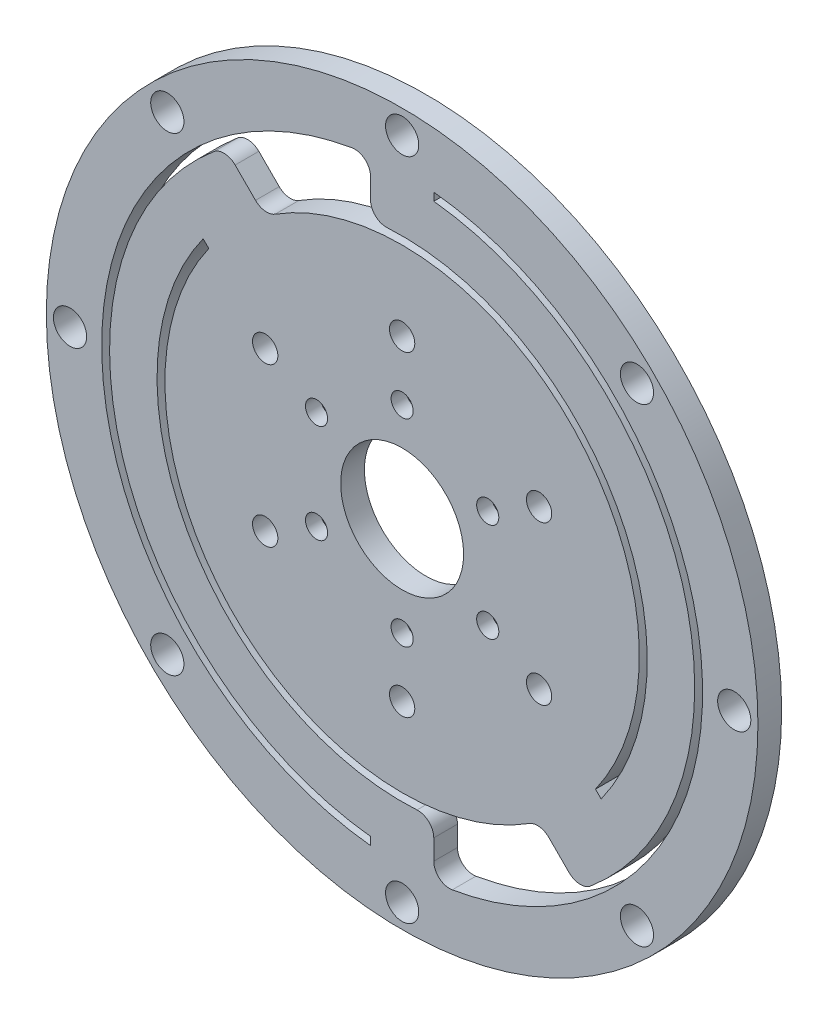
from build123d import *
from build123d.topology import SkipClean

# Parameters (mm, degrees)
EXTRUDE_1_OUTLINE_R      = 45
EXTRUDE_1_OUTLINE_R_2    = 2.1
EXTRUDE_1_OUTLINE_R_3    = 1.6
EXTRUDE_1_OUTLINE_R_4    = 7.775
EXTRUDE_1_DEPTH          = 3
CUT_EXTRUDE_1_DEPTH      = 10
PATTERN_CIRCULAR_1_COUNT = 2
CUT_EXTRUDE_2_DEPTH      = 10
FILLET_1_R               = 2
CUT_EXTRUDE_3_REACH      = 65.71
SKETCH_4_R               = 1.4
CHAMFER_1_SIZE           = 1.1


# Read off the part's stored shape, not the designer's step: 凸台-拉伸1
with BuildPart() as part:
    # 凸台-拉伸1 outline → 凸台-拉伸1 (new body)
    with BuildSketch(Plane.XY):
        Circle(EXTRUDE_1_OUTLINE_R)
        with Locations((-29.69848481, -29.69848481)):
            Circle(EXTRUDE_1_OUTLINE_R_2, mode=Mode.SUBTRACT)
        with Locations((-17.320508076, -10)):
            Circle(EXTRUDE_1_OUTLINE_R_3, mode=Mode.SUBTRACT)
        with Locations((0, -42)):
            Circle(EXTRUDE_1_OUTLINE_R_2, mode=Mode.SUBTRACT)
        with Locations((29.69848481, -29.69848481)):
            Circle(EXTRUDE_1_OUTLINE_R_2, mode=Mode.SUBTRACT)
        with Locations((0, -20)):
            Circle(EXTRUDE_1_OUTLINE_R_3, mode=Mode.SUBTRACT)
        with Locations((17.320508076, -10)):
            Circle(EXTRUDE_1_OUTLINE_R_3, mode=Mode.SUBTRACT)
        with Locations((-42, 0)):
            Circle(EXTRUDE_1_OUTLINE_R_2, mode=Mode.SUBTRACT)
        with Locations((-17.320508076, 10)):
            Circle(EXTRUDE_1_OUTLINE_R_3, mode=Mode.SUBTRACT)
        with Locations((-29.69848481, 29.69848481)):
            Circle(EXTRUDE_1_OUTLINE_R_2, mode=Mode.SUBTRACT)
        Circle(EXTRUDE_1_OUTLINE_R_4, mode=Mode.SUBTRACT)
        with Locations((17.320508076, 10)):
            Circle(EXTRUDE_1_OUTLINE_R_3, mode=Mode.SUBTRACT)
        with Locations((0, 20)):
            Circle(EXTRUDE_1_OUTLINE_R_3, mode=Mode.SUBTRACT)
        with Locations((42, 0)):
            Circle(EXTRUDE_1_OUTLINE_R_2, mode=Mode.SUBTRACT)
        with Locations((0, 42)):
            Circle(EXTRUDE_1_OUTLINE_R_2, mode=Mode.SUBTRACT)
        with Locations((29.69848481, 29.69848481)):
            Circle(EXTRUDE_1_OUTLINE_R_2, mode=Mode.SUBTRACT)
    extrude(amount=EXTRUDE_1_DEPTH)

    # 草图2 → 切除-拉伸1 (cut)
    with BuildSketch(Plane.XY.offset(3)):
        with BuildLine():
            Line((4, 37.788887255), (4, 36.783148315))
            ThreePointArc((4, 36.783148315), (35.651970274, 9.896313233), (22.387428888, -29.4584967))
            Line((22.387428888, -29.4584967), (17.380966757, -24.452034569))
            ThreePointArc((17.380966757, -24.452034569), (16.963906124, -24.743198844), (16.541969004, -25.027250378))
            Line((16.541969004, -25.027250378), (22.290357636, -30.77563901))
            ThreePointArc((22.290357636, -30.77563901), (36.716063128, 9.794422308), (4, 37.788887255))
        make_face()
        with BuildLine():
            Line((-4, 37.788887255), (-4, 30.740852298))
            ThreePointArc((-4, 30.740852298), (26.614522572, 15.895508431), (25.168841559, -18.097773747))
            Line((25.168841559, -18.097773747), (24.452034569, -17.380966757))
            ThreePointArc((24.452034569, -17.380966757), (25.41530796, 15.93932625), (-5, 29.580398915))
            Line((-5, 29.580398915), (-5, 37.669616404))
            ThreePointArc((-5, 37.669616404), (-4.500395136, 37.732564763), (-4, 37.788887255))
        make_face()
    cut_extrude_1 = extrude(amount=-CUT_EXTRUDE_1_DEPTH, mode=Mode.SUBTRACT)

    # 阵列(圆周)1: 切除-拉伸1 ×2 about axis
    pattern_circular_1_axis = Axis((0, 0, 0), (0, 0, 1))
    for i in range(1, PATTERN_CIRCULAR_1_COUNT):
        add(cut_extrude_1.rotate(pattern_circular_1_axis, i * 360 / PATTERN_CIRCULAR_1_COUNT), mode=Mode.SUBTRACT)

    # 草图3 → 切除-拉伸2 (cut)
    with SkipClean():  # the faces are left unmerged after this step: merging them gives an invalid solid
        with BuildSketch(Plane.XY.offset(3)):
            with BuildLine():
                Line((-5, 37.669616404), (-5, 29.580398915))
                ThreePointArc((-5, 29.580398915), (-11.00894625, 27.907043958), (-16.541969004, 25.027250378))
                Line((-16.541969004, 25.027250378), (-22.290357636, 30.77563901))
                ThreePointArc((-22.290357636, 30.77563901), (-14.073828052, 35.297696298), (-5, 37.669616404))
            make_face()
            with BuildLine():
                Line((16.541969004, -25.027250378), (22.290357636, -30.77563901))
                ThreePointArc((22.290357636, -30.77563901), (14.073828052, -35.297696298), (5, -37.669616404))
                Line((5, -37.669616404), (5, -29.580398915))
                ThreePointArc((5, -29.580398915), (11.00894625, -27.907043958), (16.541969004, -25.027250378))
            make_face()
        extrude(amount=-CUT_EXTRUDE_2_DEPTH, mode=Mode.SUBTRACT)

    # 圆角1
    fillet_1_edges = [part.edges().sort_by_distance(p)[0] for p in [
        (4, -37.788887255, 1.5),
        (4, -30.740852298, 1.5),
        (-17.380966757, 24.452034569, 1.5),
        (-22.387428888, 29.4584967, 1.5),
        (-4, 37.788887255, 1.5),
        (-4, 30.740852298, 1.5),
        (17.380966757, -24.452034569, 1.5),
        (22.387428888, -29.4584967, 1.5),
    ]]
    fillet(fillet_1_edges, radius=FILLET_1_R)

    # 草图4 → 切除-拉伸3 (cut, up to next)
    with BuildSketch(Plane(origin=(0, 0, 0), x_dir=(-1, 0, 0), z_dir=(0, 0, -1)), mode=Mode.PRIVATE) as cut_extrude_3_sk1:
        with Locations((0, 12.5)):
            Circle(SKETCH_4_R)
    cut_extrude_3_tool1 = extrude(cut_extrude_3_sk1.sketch, amount=-CUT_EXTRUDE_3_REACH, mode=Mode.PRIVATE) & part.part
    # 草图4 → 切除-拉伸3 (cut, up to next)
    with BuildSketch(Plane(origin=(0, 0, 0), x_dir=(-1, 0, 0), z_dir=(0, 0, -1)), mode=Mode.PRIVATE) as cut_extrude_3_sk2:
        with Locations((10.825317547, 6.25)):
            Circle(SKETCH_4_R)
    cut_extrude_3_tool2 = extrude(cut_extrude_3_sk2.sketch, amount=-CUT_EXTRUDE_3_REACH, mode=Mode.PRIVATE) & part.part
    # 草图4 → 切除-拉伸3 (cut, up to next)
    with BuildSketch(Plane(origin=(0, 0, 0), x_dir=(-1, 0, 0), z_dir=(0, 0, -1)), mode=Mode.PRIVATE) as cut_extrude_3_sk3:
        with Locations((10.825317547, -6.25)):
            Circle(SKETCH_4_R)
    cut_extrude_3_tool3 = extrude(cut_extrude_3_sk3.sketch, amount=-CUT_EXTRUDE_3_REACH, mode=Mode.PRIVATE) & part.part
    # 草图4 → 切除-拉伸3 (cut, up to next)
    with BuildSketch(Plane(origin=(0, 0, 0), x_dir=(-1, 0, 0), z_dir=(0, 0, -1)), mode=Mode.PRIVATE) as cut_extrude_3_sk4:
        with Locations((0, -12.5)):
            Circle(SKETCH_4_R)
    cut_extrude_3_tool4 = extrude(cut_extrude_3_sk4.sketch, amount=-CUT_EXTRUDE_3_REACH, mode=Mode.PRIVATE) & part.part
    # 草图4 → 切除-拉伸3 (cut, up to next)
    with BuildSketch(Plane(origin=(0, 0, 0), x_dir=(-1, 0, 0), z_dir=(0, 0, -1)), mode=Mode.PRIVATE) as cut_extrude_3_sk5:
        with Locations((-10.825317547, -6.25)):
            Circle(SKETCH_4_R)
    cut_extrude_3_tool5 = extrude(cut_extrude_3_sk5.sketch, amount=-CUT_EXTRUDE_3_REACH, mode=Mode.PRIVATE) & part.part
    # 草图4 → 切除-拉伸3 (cut, up to next)
    with BuildSketch(Plane(origin=(0, 0, 0), x_dir=(-1, 0, 0), z_dir=(0, 0, -1)), mode=Mode.PRIVATE) as cut_extrude_3_sk6:
        with Locations((-10.825317547, 6.25)):
            Circle(SKETCH_4_R)
    cut_extrude_3_tool6 = extrude(cut_extrude_3_sk6.sketch, amount=-CUT_EXTRUDE_3_REACH, mode=Mode.PRIVATE) & part.part
    add(cut_extrude_3_tool1.solids().sort_by_distance((0, 12.5, 0))[0], mode=Mode.SUBTRACT)
    add(cut_extrude_3_tool2.solids().sort_by_distance((-10.825318, 6.25, 0))[0], mode=Mode.SUBTRACT)
    add(cut_extrude_3_tool3.solids().sort_by_distance((-10.825318, -6.25, 0))[0], mode=Mode.SUBTRACT)
    add(cut_extrude_3_tool4.solids().sort_by_distance((0, -12.5, 0))[0], mode=Mode.SUBTRACT)
    add(cut_extrude_3_tool5.solids().sort_by_distance((10.825318, -6.25, 0))[0], mode=Mode.SUBTRACT)
    add(cut_extrude_3_tool6.solids().sort_by_distance((10.825318, 6.25, 0))[0], mode=Mode.SUBTRACT)

    # 倒角1
    chamfer_1_edges = [part.edges().sort_by_distance(p)[0] for p in [
        (1.4, 12.5, 0),
        (12.225317547, 6.25, 0),
        (12.225317547, -6.25, 0),
        (1.4, -12.5, 0),
        (-9.425317547, -6.25, 0),
        (-9.425317547, 6.25, 0),
    ]]
    chamfer(chamfer_1_edges, length=CHAMFER_1_SIZE)


solid = part.part
